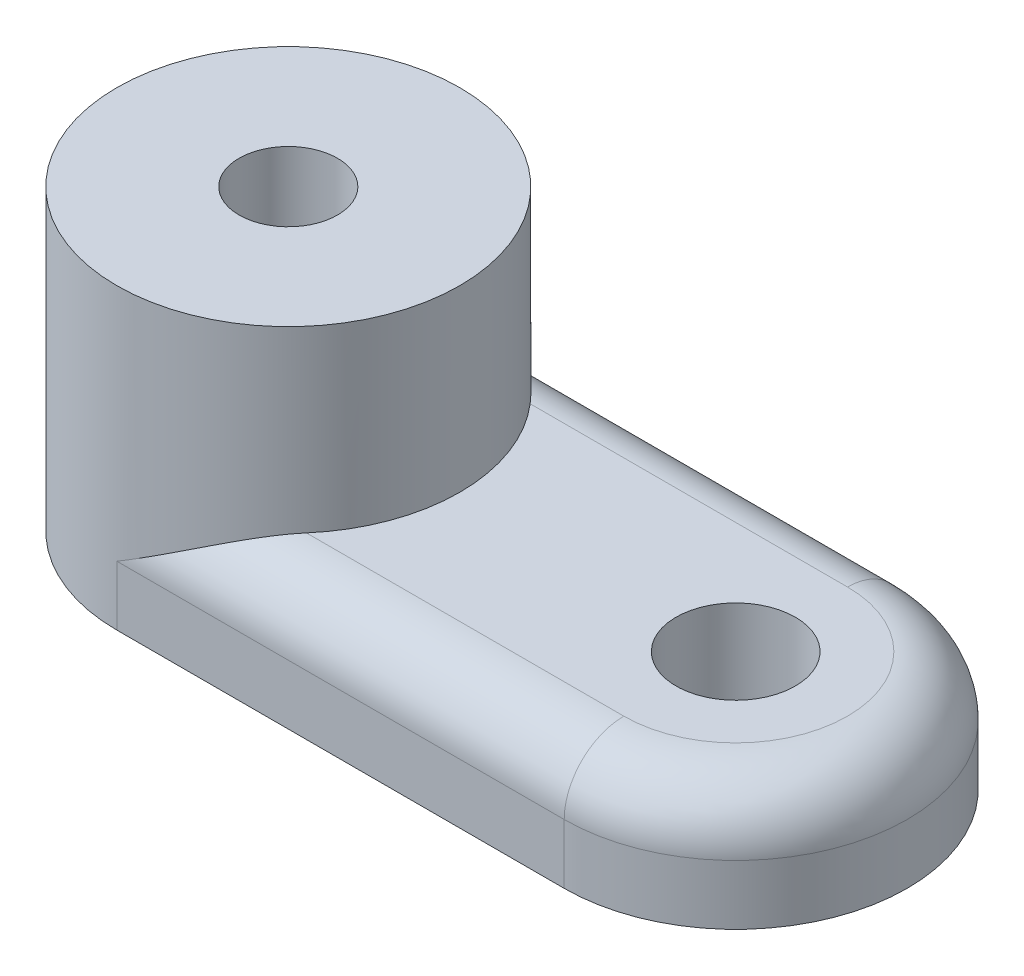
from build123d import *

# Parameters (mm, degrees)
SKETCH1_R           = 5.75
SKETCH1_R_2         = 1.65
BOSS_EXTRUDE1_DEPTH = 10
SKETCH2_R           = 2
BOSS_EXTRUDE2_DEPTH = 4
FILLET1_R           = 2


with BuildPart() as part:
    # Sketch1 → Boss-Extrude1 (new body)
    with BuildSketch(Plane(origin=(0, 0, 0), x_dir=(1, 0, 0), z_dir=(0, 1, 0))):
        with Locations(Location((0, 0, 0), (0, 0, 270))):
            Circle(SKETCH1_R)
        with Locations(Location((0, 0, 0), (0, 0, 270))):
            Circle(SKETCH1_R_2, mode=Mode.SUBTRACT)
    extrude(amount=BOSS_EXTRUDE1_DEPTH)

    # Sketch2 → Boss-Extrude2 (add)
    # profile 1 of 4: a face of its own
    with BuildSketch(Plane.XZ):
        with BuildLine():
            ThreePointArc((20.75, 0), (19.065863992, 4.065863992), (15, 5.75))
            Line((15, 5.75), (9.25, 0))
            Line((9.25, 0), (15, -5.75))
            ThreePointArc((15, -5.75), (19.065863992, -4.065863992), (20.75, 0))
        make_face()
        with Locations(Location((15, 0, 0), (0, 0, 270))):
            Circle(SKETCH2_R, mode=Mode.SUBTRACT)
    # profile 2 of 4: a face of its own
    with BuildSketch(Plane.XZ):
        with BuildLine():
            Line((9.25, 0), (15, 5.75))
            ThreePointArc((15, 5.75), (10.934136008, 4.065863992), (9.25, 0))
        make_face()
    # profile 3 of 4: a face of its own
    with BuildSketch(Plane.XZ):
        with BuildLine():
            ThreePointArc((9.25, 0), (10.934136008, 4.065863992), (15, 5.75))
            Line((15, 5.75), (0, 5.75))
            ThreePointArc((0, 5.75), (4.065863992, 4.065863992), (5.75, 0))
            ThreePointArc((5.75, 0), (4.065863992, -4.065863992), (0, -5.75))
            Line((0, -5.75), (15, -5.75))
            ThreePointArc((15, -5.75), (10.934136008, -4.065863992), (9.25, 0))
        make_face()
    # profile 4 of 4: a face of its own
    with BuildSketch(Plane.XZ):
        with BuildLine():
            Line((15, -5.75), (9.25, 0))
            ThreePointArc((9.25, 0), (10.934136008, -4.065863992), (15, -5.75))
        make_face()
    extrude(amount=-BOSS_EXTRUDE2_DEPTH)

    # Fillet1
    # the kernel refuses this fillet: 2 mm, written as the material it takes off along each edge
    with BuildSketch(Plane(origin=(-5, 4, -5.75), x_dir=(0, 0, 1), z_dir=(1, 0, 0))) as fillet1_piece_1_section:
        with BuildLine():
            CenterArc((FILLET1_R, FILLET1_R), FILLET1_R, 180, 90)
            Line((0, FILLET1_R), (0, 0))
            Line((0, 0), (FILLET1_R, 0))
        make_face()
    fillet1_piece_1 = extrude(amount=20, mode=Mode.PRIVATE)
    fillet1_piece_1 = fillet1_piece_1 - Plane(origin=(0, 3.514129047, 0), x_dir=(0, 0, 1), z_dir=(0, -1, 0)) * Cylinder(5.75, 48, mode=Mode.PRIVATE)
    add(fillet1_piece_1, mode=Mode.SUBTRACT)
    with BuildSketch(Plane(origin=(15, 4, 5.75), x_dir=(0, -1, 0), z_dir=(-1, 0, 0))) as fillet1_piece_2_section:
        with BuildLine():
            CenterArc((FILLET1_R, -FILLET1_R), FILLET1_R, 90, 90)
            Line((0, -FILLET1_R), (0, 0))
            Line((0, 0), (FILLET1_R, 0))
        make_face()
    fillet1_piece_2 = extrude(amount=20, mode=Mode.PRIVATE)
    fillet1_piece_2 = fillet1_piece_2 - Plane(origin=(0, 3.514130378, 0), x_dir=(0, 0, 1), z_dir=(0, -1, 0)) * Cylinder(5.75, 48, mode=Mode.PRIVATE)
    add(fillet1_piece_2, mode=Mode.SUBTRACT)
    with BuildSketch(Plane(origin=(15, 4, 0), x_dir=(0, 0, -1), z_dir=(-1, 0, 0))) as fillet1_piece_3:
        with BuildLine():
            CenterArc((5.75 - FILLET1_R, FILLET1_R), FILLET1_R, 270, 90)
            Line((5.75, FILLET1_R), (5.75, 0))
            Line((5.75, 0), (5.75 - FILLET1_R, 0))
        make_face()
    revolve(axis=Axis((15, 4, 0), (0, -1, 0)), revolution_arc=180, mode=Mode.SUBTRACT)


solid = part.part
